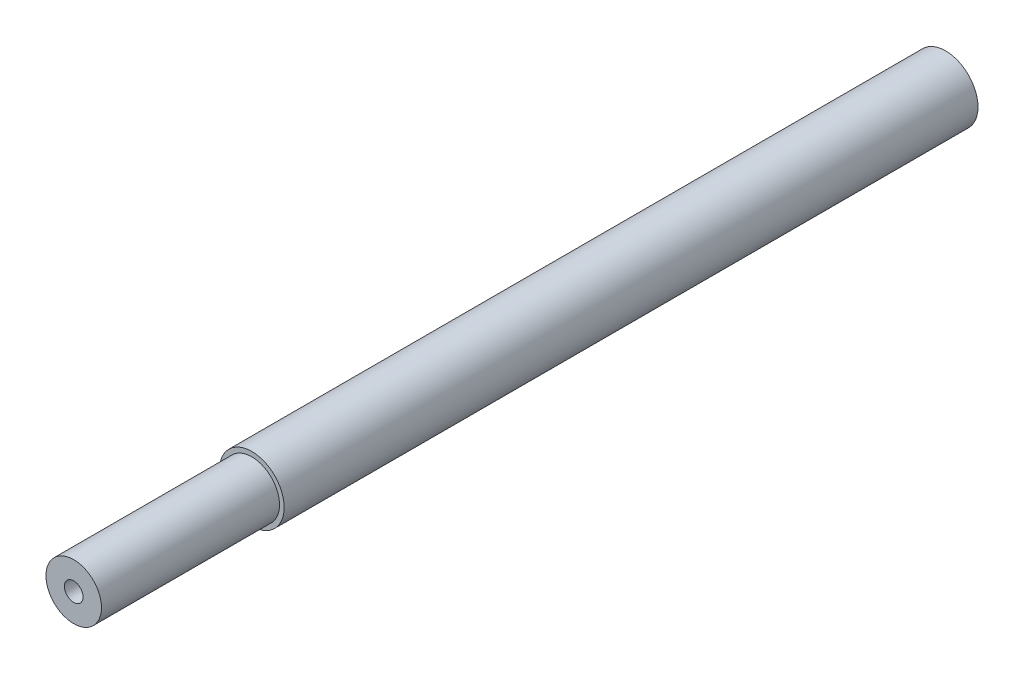
from build123d import *

# Parameters (mm, degrees)
SKETCH2_R          = 2.0193
CUT_EXTRUDE1_DEPTH = 25


with BuildPart() as part:
    # Sketch1 → Revolve1 (revolve)
    with BuildSketch(Plane(origin=(0, 0, 0), x_dir=(0, 0, -1), z_dir=(1, 0, 0))):
        Polygon((183, 0), (183, 7), (33, 7), (33, 6), (-5.5, 6), (-5.5, 0), align=None)
    revolve(axis=Axis((0, 0, 0), (0, 0, -1)))

    # Sketch2 → Cut-Extrude1 (cut)
    with BuildSketch(Plane.XY.offset(5.5)):
        Circle(SKETCH2_R)
    extrude(amount=-CUT_EXTRUDE1_DEPTH, mode=Mode.SUBTRACT)


solid = part.part
